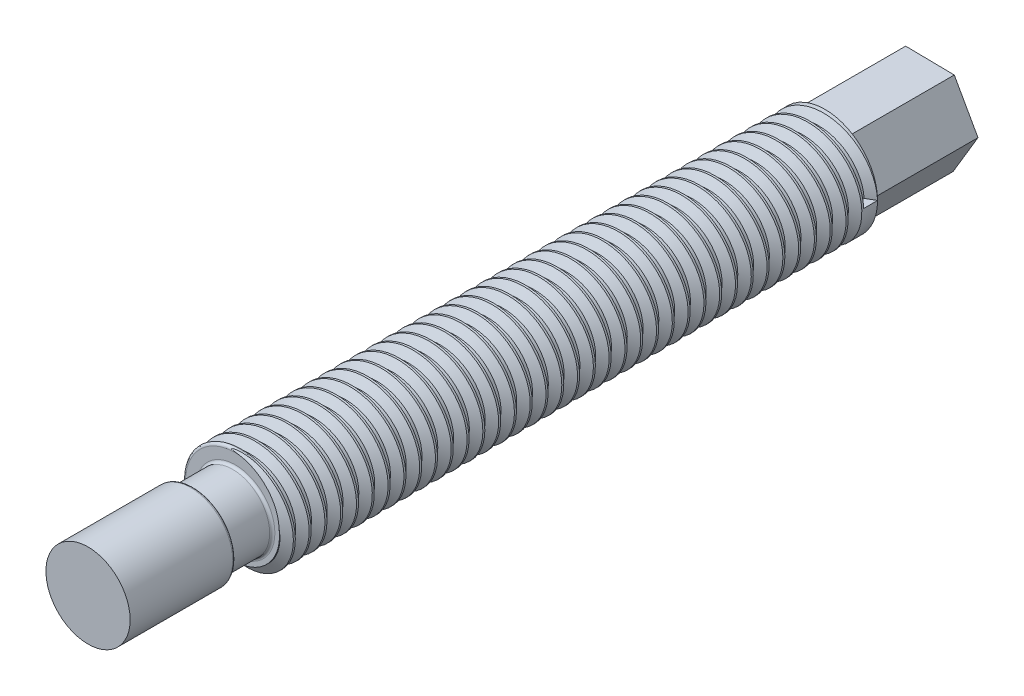
from build123d import *

# Parameters (mm, degrees)
SKETCH1_R           = 5
BOSS_EXTRUDE1_DEPTH = 80
CUT_EXTRUDE1_START  = -10
SKETCH4_R           = 5
SKETCH4_R_2         = 4
CUT_EXTRUDE1_DEPTH  = 10
CUT_EXTRUDE2_START  = -4
SKETCH5_R           = 5
SKETCH5_R_2         = 3.5
CUT_EXTRUDE2_DEPTH  = 4
FILLET1_R           = 0.25
SKETCH9_R           = 5
CUT_EXTRUDE3_DEPTH  = 10
THREAD1_PITCH       = 1.5


with BuildPart() as part:
    # Sketch1 → Boss-Extrude1 (new body)
    with BuildSketch(Plane.XY):
        Circle(SKETCH1_R)
    extrude(amount=BOSS_EXTRUDE1_DEPTH)

    # Sketch4 → Cut-Extrude1 (cut)
    with BuildSketch(Plane.XY.offset(80).offset(CUT_EXTRUDE1_START)):
        Circle(SKETCH4_R)
        Circle(SKETCH4_R_2, mode=Mode.SUBTRACT)
    extrude(amount=CUT_EXTRUDE1_DEPTH, mode=Mode.SUBTRACT)

    # Sketch5 → Cut-Extrude2 (cut)
    with BuildSketch(Plane.XY.offset(70).offset(CUT_EXTRUDE2_START)):
        Circle(SKETCH5_R)
        Circle(SKETCH5_R_2, mode=Mode.SUBTRACT)
    extrude(amount=CUT_EXTRUDE2_DEPTH, mode=Mode.SUBTRACT)

    # Fillet1
    fillet1_edges = [part.edges().sort_by_distance(p)[0] for p in [
        (-4, 0, 70),
        (-5, 0, 66),
        (-3.5, 0, 66),
        (-3.5, 0, 70),
    ]]
    fillet(fillet1_edges, radius=FILLET1_R - 0.0001)  # a hair under: the kernel refuses the full size

    # Sketch9 → Cut-Extrude3 (cut)
    with BuildSketch(Plane(origin=(0, 0, 0), x_dir=(-1, 0, 0), z_dir=(0, 0, -1))):
        Circle(SKETCH9_R)
        Polygon((2.331229728, 4.0317832), (-2.287124238, 3.967440516), (-4.540578821, -0.064342685), (-2.175679439, -4.0317832), (2.442674527, -3.967440516), (4.69612911, 0.064342685), align=None, mode=Mode.SUBTRACT)
    extrude(amount=-CUT_EXTRUDE3_DEPTH, mode=Mode.SUBTRACT)

    # Thread1: the profile of Thread Profile2 profile screwed along a right-hand helix of 37.333333 turns, 8 arcs to a turn; built about Z, then put on its axis
    thread1_z = Axis((0, 0, 0), (0, 0, 1))
    thread1_corners = [(5.0003, 0, -0.000173205), (5.0003, 0, 1.312673201), (4.188101187, 0, 0.843749998), (4.188101187, 0, 0.468749998)]
    with BuildLine(mode=Mode.PRIVATE) as thread1_profile:
        Line(thread1_corners[0], thread1_corners[1])
        Line(thread1_corners[1], thread1_corners[2])
        Line(thread1_corners[2], thread1_corners[3])
        Line(thread1_corners[3], thread1_corners[0])
    thread1_cap = Face(thread1_profile.wire())
    thread1_turn_angles = [0, 22.5, 45, 67.5, 90, 112.5, 135, 157.5, 180, 202.5, 225, 247.5, 270, 292.5, 315, 337.5, 360]
    thread1_turn_weights = [1, 0.9238795325112867, 1, 0.9238795325112867, 1, 0.9238795325112867, 1, 0.9238795325112867, 1, 0.9238795325112867, 1, 0.9238795325112867, 1, 0.9238795325112867, 1, 0.9238795325112867, 1]
    thread1_turn_rails = [Edge.make_bspline([Vector(p[0], p[1], 0).rotate(thread1_z, thread1_turn_angles[k]) / thread1_turn_weights[k] + Vector(0, 0, p[2] + THREAD1_PITCH * thread1_turn_angles[k] / 360) for k in range(17)], [0, 0, 0, 1, 1, 2, 2, 3, 3, 4, 4, 5, 5, 6, 6, 7, 7, 8, 8, 8], 2, thread1_turn_weights) for p in thread1_corners]
    thread1_turn_sides = [Face.make_surface_from_curves(thread1_turn_rails[p[0]], thread1_turn_rails[p[1]]) for p in [(0, 1), (1, 2), (2, 3), (3, 0)]]
    thread1_last_angles = [13320, 13342.5, 13365, 13387.5, 13410, 13425, 13440]
    thread1_last_weights = [1, 0.9238795325112867, 1, 0.9238795325112867, 1, 0.9659258262890683, 1]
    thread1_last_rails = [Edge.make_bspline([Vector(p[0], p[1], 0).rotate(thread1_z, thread1_last_angles[k]) / thread1_last_weights[k] + Vector(0, 0, p[2] + THREAD1_PITCH * thread1_last_angles[k] / 360) for k in range(7)], [0, 0, 0, 1, 1, 2, 2, 3, 3, 3], 2, thread1_last_weights) for p in thread1_corners]
    thread1_last_sides = [Face.make_surface_from_curves(thread1_last_rails[p[0]], thread1_last_rails[p[1]]) for p in [(0, 1), (1, 2), (2, 3), (3, 0)]]
    thread1 = Plane(origin=(0, 0, 10), x_dir=(1, 0, 0), z_dir=(0, 0, 1)) * Solid(Shell([*[p.moved(Location((0, 0, THREAD1_PITCH * i))) for i in range(37) for p in thread1_turn_sides], *thread1_last_sides, thread1_cap, thread1_cap.rotate(thread1_z, 13440).moved(Location((0, 0, THREAD1_PITCH * 13440 / 360)))]))
    add(thread1, mode=Mode.SUBTRACT)


solid = part.part
